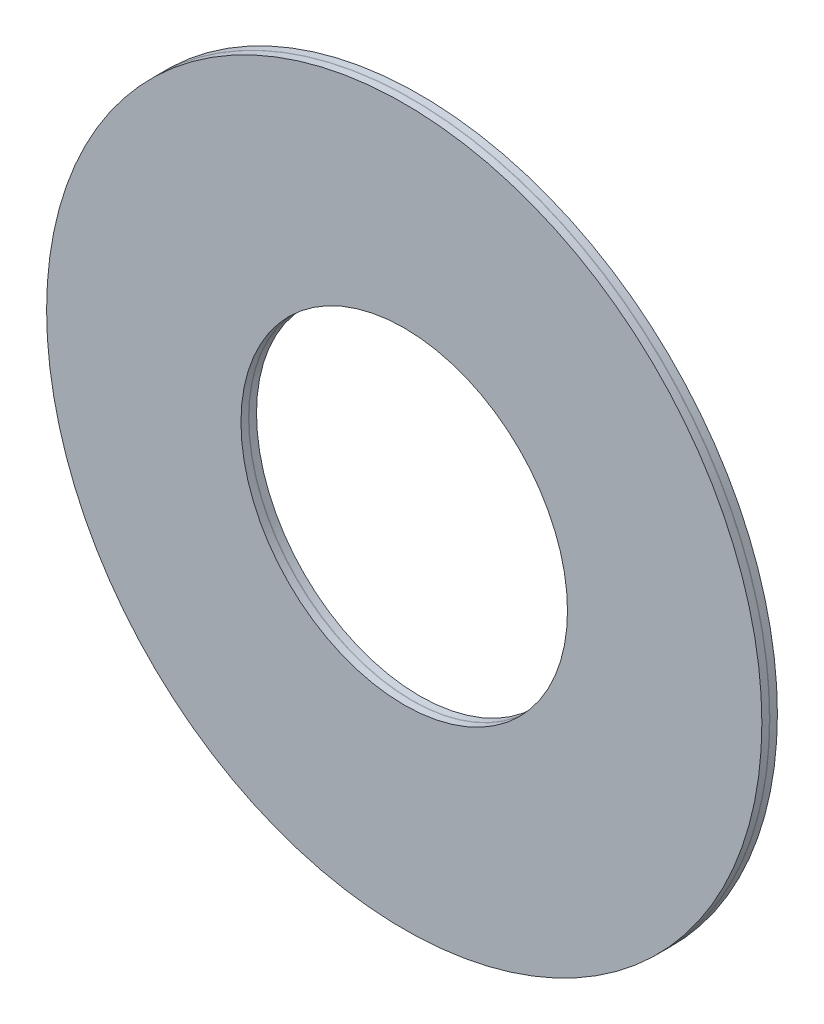
from build123d import *

# Parameters (mm, degrees)
SKETCH3_W = 0.0508
SKETCH3_H = 19.84375
SKETCH4_W = 0.76835
SKETCH4_H = 19.84375


with BuildPart() as part:
    # Sketch3 → Revolve1 (revolve)
    with BuildSketch(Plane(origin=(0, 0, 0), x_dir=(0, 0, -1), z_dir=(1, 0, 0))):
        with Locations((0, 26.590625)):
            Rectangle(SKETCH3_W, SKETCH3_H)
    revolve(axis=Axis((0, 0, -0.79375), (0, 0, 1)))


with BuildPart() as body_2:
    # Sketch4 → Revolve2 (revolve)
    with BuildSketch(Plane(origin=(0, 0, 0), x_dir=(0, 0, -1), z_dir=(1, 0, 0))):
        with Locations((-0.409575, 26.590625)):
            Rectangle(SKETCH4_W, SKETCH4_H)
        with Locations((0.409575, 26.590625)):
            Rectangle(SKETCH4_W, SKETCH4_H)
    revolve(axis=Axis((0, 0, -0.79375), (0, 0, 1)))


solid = Compound([part.part, body_2.part])
